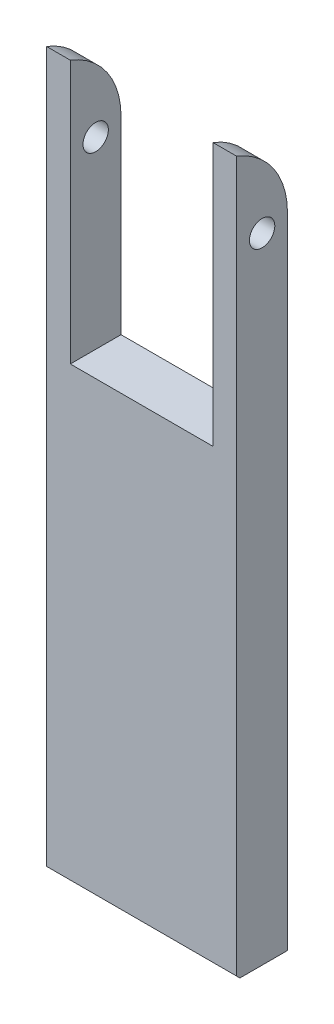
from build123d import *

# Parameters (mm, degrees)
SKETCH1_W               = 60
SKETCH1_H               = 250
BOSS_EXTRUDE1_DEPTH     = 16
CHAMFER2_SIZE           = 1
SKETCH2_R               = 2
CUT_EXTRUDE1_DEPTH      = 15
SKETCH3_W               = 45
SKETCH3_H               = 50
CUT_EXTRUDE2_DEPTH      = 258.596583828
CUT_EXTRUDE3_DEPTH      = 256.953609078
CUT_EXTRUDE3_DEPTH_BACK = 256.953609078
SKETCH4_R               = 4
SKETCH5_W               = 60
SKETCH5_H               = 25
CUT_EXTRUDE4_DEPTH      = 258.596583828
ESBO_O1_W               = 45
ESBO_O1_H               = 33
CORTE_EXTRUS_O1_DEPTH   = 234.411653522
FILETE1_R               = 25


with BuildPart() as part:
    # Sketch1 → Boss-Extrude1 (new body)
    with BuildSketch(Plane.XY):
        with Locations((30, 125)):
            Rectangle(SKETCH1_W, SKETCH1_H)
    extrude(amount=BOSS_EXTRUDE1_DEPTH)

    # Chamfer2
    chamfer2_edges = [part.edges().sort_by_distance(p)[0] for p in [
        (30, 0, 16),
    ]]
    chamfer(chamfer2_edges, length=CHAMFER2_SIZE)

    # Sketch2 → Cut-Extrude1 (cut)
    with BuildSketch(Plane(origin=(0, 0, 0), x_dir=(-1, 0, 0), z_dir=(0, -1, 0))):
        with Locations(Location((-41.5, -7.5, 0), (0, 0, 90))):
            Circle(SKETCH2_R)
        with Locations(Location((-18.5, -7.5, 0), (0, 0, 90))):
            Circle(SKETCH2_R)
    extrude(amount=-CUT_EXTRUDE1_DEPTH, mode=Mode.SUBTRACT)

    # Sketch3 → Cut-Extrude2 (cut, through all)
    with BuildSketch(Plane(origin=(0, 0, 0), x_dir=(-1, 0, 0), z_dir=(0, 0, -1))):
        with Locations((-30, 200)):
            Rectangle(SKETCH3_W, SKETCH3_H)
    extrude(amount=-CUT_EXTRUDE2_DEPTH, mode=Mode.SUBTRACT)

    # Sketch4 → Cut-Extrude3 (cut, two sides: drawn at the far end of the back side and taken through both)
    with BuildSketch(Plane.ZY.offset(-52.5).offset(-CUT_EXTRUDE3_DEPTH_BACK)):
        with Locations((8, 200)):
            Circle(SKETCH4_R)
    extrude(amount=CUT_EXTRUDE3_DEPTH + CUT_EXTRUDE3_DEPTH_BACK, mode=Mode.SUBTRACT)

    # Sketch5 → Cut-Extrude4 (cut, through all)
    with BuildSketch(Plane(origin=(0, 0, 0), x_dir=(-1, 0, 0), z_dir=(0, 0, -1))):
        with Locations((-30, 237.5)):
            Rectangle(SKETCH5_W, SKETCH5_H)
    extrude(amount=-CUT_EXTRUDE4_DEPTH, mode=Mode.SUBTRACT)

    # Esboço1 → Corte-extrusão1 (cut, through all)
    with BuildSketch(Plane(origin=(0, 0, 0), x_dir=(-1, 0, 0), z_dir=(0, 0, -1))):
        with Locations((-30, 158.5)):
            Rectangle(ESBO_O1_W, ESBO_O1_H)
    extrude(amount=-CORTE_EXTRUS_O1_DEPTH, mode=Mode.SUBTRACT)

    # Filete1
    # the kernel refuses this fillet: 25 mm, written as the material it takes off along each edge
    with BuildSketch(Plane(origin=(-5.809518948, 225, 0), x_dir=(0, 0, 1), z_dir=(1, 0, 0)), Plane(origin=(-58.309518948, 225, 0), x_dir=(0, 0, 1), z_dir=(1, 0, 0))) as filete1_piece_1:
        with BuildLine():
            CenterArc((25, 23.323807579), FILETE1_R, 180, 68.899803976)
            Line((0, 23.323807579), (-0.5, 23.323807579))
            Line((-0.5, 23.323807579), (-0.5, 0))
            Line((-0.5, 0), (0, -0.5))
            ThreePointArc((0, -0.5), (8, -0.5), (15.82, -0.466476152))
            Line((15.82, -0.466476152), (16, 0))
        make_face()
    extrude(amount=124.119037897, mode=Mode.SUBTRACT)


solid = part.part
